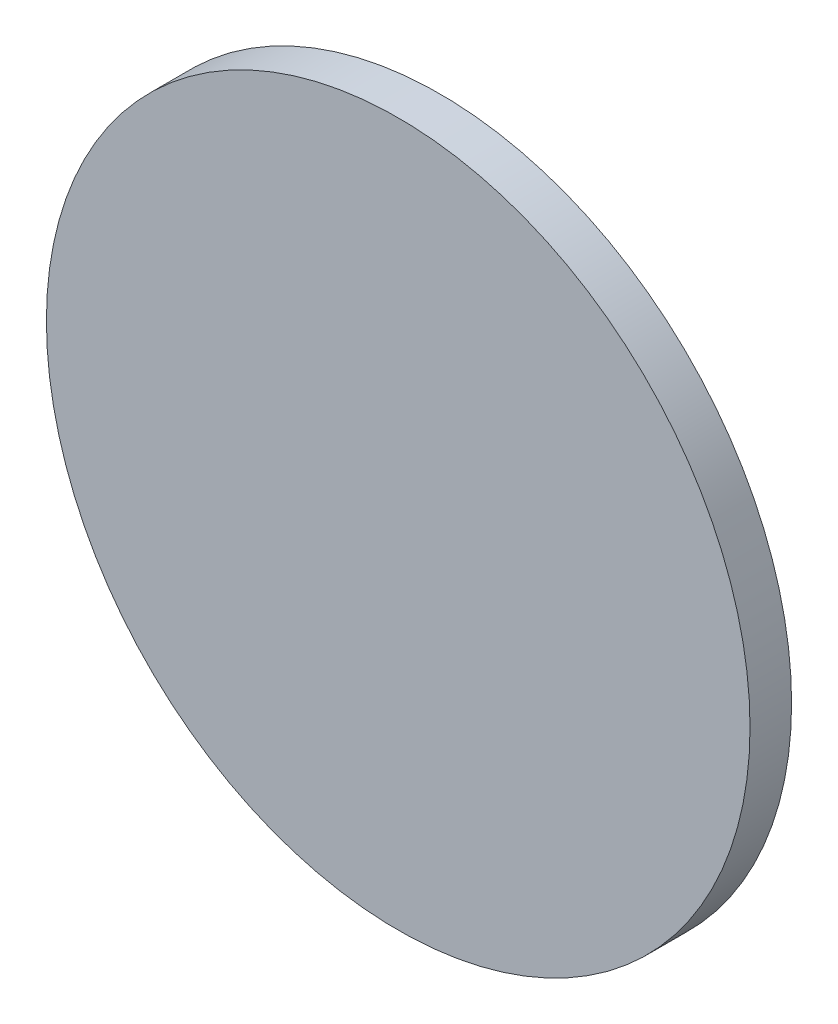
from build123d import *

# Parameters (mm, degrees)
SKETCH2_R           = 25.4
BOSS_EXTRUDE1_DEPTH = 3


with BuildPart() as part:
    # Sketch2 → Boss-Extrude1 (new body)
    with BuildSketch(Plane.XY):
        Circle(SKETCH2_R)
    extrude(amount=BOSS_EXTRUDE1_DEPTH)


solid = part.part
